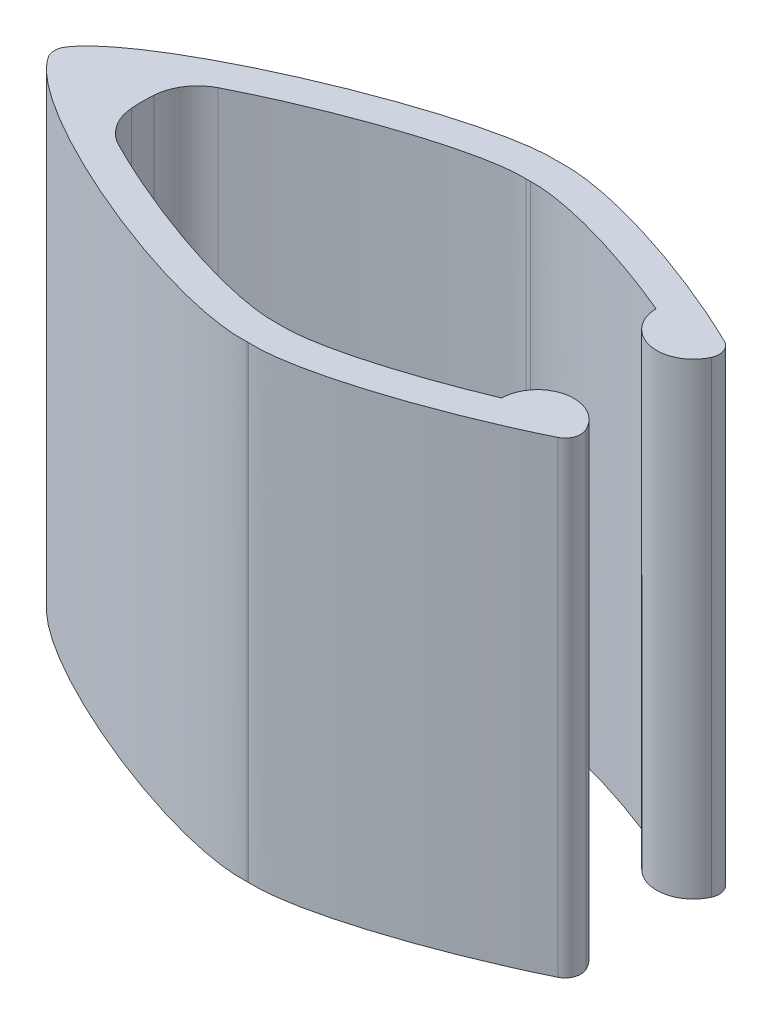
from build123d import *

# Parameters (mm, degrees)
BOSS_EXTRUDE1_DEPTH = 30
FILLET1_R           = 1
SHELL1_T            = -2
CUT_EXTRUDE1_REACH  = 48.182
SKETCH3_W           = 10
SKETCH3_H           = 30
BOSS_EXTRUDE2_DEPTH = 30
BOSS_EXTRUDE4_START = -30
BOSS_EXTRUDE4_DEPTH = 30
FILLET2_R           = 3
FILLET3_R           = 1


# Read off the part's stored shape, not the designer's step: Boss-Extrude4
with BuildPart() as part:
    # Sketch1 → Boss-Extrude1 (new body)
    with BuildSketch(Plane(origin=(0, 0, 0), x_dir=(1, 0, 0), z_dir=(0, 1, 0))):
        with BuildLine():
            add(Edge.make_bspline(
                [(-11.25, 10), (-5.781911856, 10.311342007), (10.269870792, 3.454667183), (11.25, 0)],
                knots=[0.452930386, 0.452930386, 0.452930386, 0.452930386, 1, 1, 1, 1], degree=3))
            add(Edge.make_bspline(
                [(-11.25, -10), (-5.781911856, -10.311342007), (10.269870792, -3.454667183), (11.25, 0)],
                knots=[0.452930386, 0.452930386, 0.452930386, 0.452930386, 1, 1, 1, 1], degree=3))
            add(Edge.make_bspline(
                [(-11.25, -10), (-16.718088144, -10.311342007), (-32.769870792, -3.454667183), (-33.75, 0)],
                knots=[0.452930386, 0.452930386, 0.452930386, 0.452930386, 1, 1, 1, 1], degree=3))
            add(Edge.make_bspline(
                [(-11.25, 10), (-16.718088144, 10.311342007), (-32.769870792, 3.454667183), (-33.75, 0)],
                knots=[0.452930386, 0.452930386, 0.452930386, 0.452930386, 1, 1, 1, 1], degree=3))
        make_face()
    extrude(amount=BOSS_EXTRUDE1_DEPTH)

    # Fillet1
    fillet1_edges = [part.edges().sort_by_distance(p)[0] for p in [
        (-33.75, 15, 0),
        (-11.25, 15, -10),
        (11.25, 15, 0),
        (-11.25, 15, 10),
    ]]
    fillet(fillet1_edges, radius=FILLET1_R)

    # Shell1
    shell1_openings = [part.faces().sort_by_distance(p)[0] for p in [
        (-11.25, 30, 0),
        (-11.25, 0, 0),
    ]]
    offset(amount=SHELL1_T, openings=shell1_openings)

    # Sketch3 → Cut-Extrude1 (cut, up to next)
    with BuildSketch(Plane(origin=(0, 0, 0), x_dir=(0, 0, -1), z_dir=(1, 0, 0)), mode=Mode.PRIVATE) as cut_extrude1_sk1:
        with Locations((0, 15)):
            Rectangle(SKETCH3_W, SKETCH3_H)
    cut_extrude1_tool1 = extrude(cut_extrude1_sk1.sketch, amount=CUT_EXTRUDE1_REACH, mode=Mode.PRIVATE) & part.part
    add(cut_extrude1_tool1.solids().sort_by_distance((0, 15, 0))[0], mode=Mode.SUBTRACT)

    # Sketch4 → Boss-Extrude2 (add)
    with BuildSketch(Plane(origin=(0, 30, 0), x_dir=(1, 0, 0), z_dir=(0, 1, 0))):
        with BuildLine():
            Line((4.683590917, 5), (0, 5))
            ThreePointArc((0, 5), (2.341795458, 2.658204542), (4.683590917, 5))
        make_face()
        with BuildLine():
            Line((0, -5), (4.683590917, -5))
            ThreePointArc((4.683590917, -5), (2.341795458, -2.658204542), (0, -5))
        make_face()
    extrude(amount=-BOSS_EXTRUDE2_DEPTH)

    # Boss-Extrude4 outline → Boss-Extrude4 (add)
    with BuildSketch(Plane(origin=(0, 30, 0), x_dir=(1, 0, 0), z_dir=(0, 1, 0)).offset(BOSS_EXTRUDE4_START)):
        with BuildLine():
            ThreePointArc((-27.69069648, -2.46787393), (-28, 0), (-27.69069648, 2.46787393))
            add(Edge.make_bspline(
                [(-27.69069648, 2.46787393), (-27.822031215, 2.39499699), (-27.951900256, 2.322199534), (-28.080260991, 2.249502833), (-28.20707038, 2.176928557), (-28.332284982, 2.10449893), (-28.455860917, 2.032236786), (-28.57775383, 1.960165641), (-28.697918846, 1.88830977), (-28.816310527, 1.816694288), (-28.932882823, 1.745345254), (-29.047589016, 1.674289767), (-29.395924825, 1.455844025), (-29.623125506, 1.309538219), (-29.841540019, 1.164885503), (-30.050742717, 1.022190072), (-30.250257196, 0.881746107), (-30.439599681, 0.743903891), (-30.618272334, 0.609068339), (-30.785746265, 0.477701019), (-30.941461201, 0.350349869), (-31.084828141, 0.227682248), (-31.21523231, 0.110536702), (-31.332067668, -2.7e-08)],
                knots=[0.816861964, 0.816861964, 0.816861964, 0.816861964, 0.816861964, 0.816861964, 0.816861964, 0.816861964, 0.816861964, 0.816861964, 0.816861964, 0.816861964, 0.816861964, 0.853756111, 0.853756111, 0.853756111, 0.853756111, 0.853756111, 0.853756111, 0.853756111, 0.853756111, 0.853756111, 0.853756111, 0.853756111, 0.930801589, 0.930801589, 0.930801589, 0.930801589, 0.930801589, 0.930801589, 0.930801589, 0.930801589, 0.930801589, 0.930801589, 0.930801589, 0.930801589, 0.930801589], degree=12))
            add(Edge.make_bspline(
                [(-27.69069648, -2.46787393), (-27.822031215, -2.39499699), (-27.951900256, -2.322199534), (-28.080260991, -2.249502833), (-28.20707038, -2.176928557), (-28.332284982, -2.10449893), (-28.455860917, -2.032236786), (-28.57775383, -1.960165641), (-28.697918846, -1.88830977), (-28.816310527, -1.816694288), (-28.932882823, -1.745345254), (-29.047589016, -1.674289767), (-29.395924825, -1.455844025), (-29.623125506, -1.309538219), (-29.841540019, -1.164885503), (-30.050742717, -1.022190072), (-30.250257196, -0.881746107), (-30.439599681, -0.743903891), (-30.618272334, -0.609068339), (-30.785746265, -0.477701019), (-30.941461201, -0.350349869), (-31.084828141, -0.227682248), (-31.21523231, -0.110536702), (-31.332067668, -2.7e-08)],
                knots=[0.816861964, 0.816861964, 0.816861964, 0.816861964, 0.816861964, 0.816861964, 0.816861964, 0.816861964, 0.816861964, 0.816861964, 0.816861964, 0.816861964, 0.816861964, 0.853756111, 0.853756111, 0.853756111, 0.853756111, 0.853756111, 0.853756111, 0.853756111, 0.853756111, 0.853756111, 0.853756111, 0.853756111, 0.930801589, 0.930801589, 0.930801589, 0.930801589, 0.930801589, 0.930801589, 0.930801589, 0.930801589, 0.930801589, 0.930801589, 0.930801589, 0.930801589, 0.930801589], degree=12))
        make_face()
    extrude(amount=BOSS_EXTRUDE4_DEPTH)

    # Fillet2
    fillet2_edges = [part.edges().sort_by_distance(p)[0] for p in [
        (-27.69069648, 15, 2.46787393),
        (-27.69069648, 15, -2.46787393),
    ]]
    fillet(fillet2_edges, radius=FILLET2_R)

    # Fillet3
    fillet3_edges = [part.edges().sort_by_distance(p)[0] for p in [
        (4.683590936, 15, -5),
        (4.683590936, 15, 5),
    ]]
    fillet(fillet3_edges, radius=FILLET3_R)


solid = part.part
